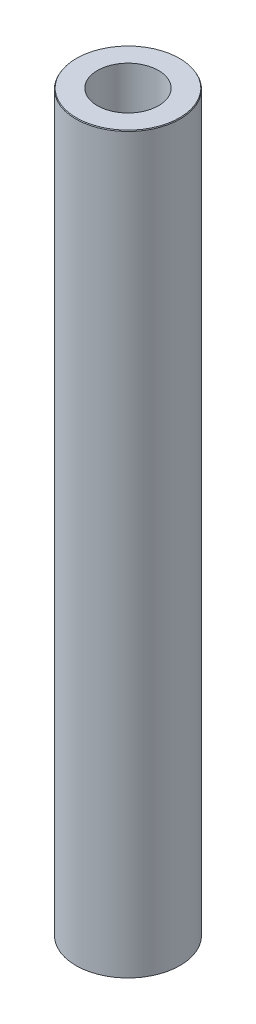
from build123d import *
from OCP.BRepFilletAPI import BRepFilletAPI_MakeChamfer

# Parameters (mm, degrees)
SKETCH1_R           = 42.5
BOSS_EXTRUDE1_DEPTH = 600
SKETCH2_R           = 24.96287268
CUT_EXTRUDE1_DEPTH  = 604.002902149
CHAMFER1_SIZE       = 0.687026591
CHAMFER1_SIZE2      = 0.396654987


with BuildPart() as part:
    # Sketch1 → Boss-Extrude1 (new body)
    with BuildSketch(Plane(origin=(0, 0, 0), x_dir=(1, 0, 0), z_dir=(0, 1, 0))):
        Circle(SKETCH1_R)
    extrude(amount=BOSS_EXTRUDE1_DEPTH)

    # Sketch2 → Cut-Extrude1 (cut, through all)
    with BuildSketch(Plane(origin=(0, 0, 0), x_dir=(1, 0, 0), z_dir=(0, 1, 0))):
        Circle(SKETCH2_R)
    extrude(amount=CUT_EXTRUDE1_DEPTH, mode=Mode.SUBTRACT)

    # Chamfer1: one chamfer whose edges measure the first distance from different faces: ONE call of the kernel's chamfer builder (chamfer() names one face for all edges)
    chamfer1_edges_1 = [part.edges().sort_by_distance(p)[0] for p in [
        (-42.5, 600, 0),
    ]]
    chamfer1_side_1 = [part.faces().sort_by_distance(p)[0] for p in [
        (-42.5, 300, 0),
    ]]
    chamfer1_edges_2 = [part.edges().sort_by_distance(p)[0] for p in [
        (-42.5, 0, 0),
    ]]
    chamfer1_side_2 = [part.faces().sort_by_distance(p)[0] for p in [
        (-41.297918472, 0, 0),
    ]]
    chamfer1 = BRepFilletAPI_MakeChamfer(part.part.solid().wrapped)
    for e in chamfer1_edges_1:
        chamfer1.Add(CHAMFER1_SIZE, CHAMFER1_SIZE2, e.wrapped, chamfer1_side_1[0].wrapped)  # the first distance lies on this face
    for e in chamfer1_edges_2:
        chamfer1.Add(CHAMFER1_SIZE, CHAMFER1_SIZE2, e.wrapped, chamfer1_side_2[0].wrapped)  # the first distance lies on this face
    add(Compound.cast(chamfer1.Shape()), mode=Mode.REPLACE)


solid = part.part
